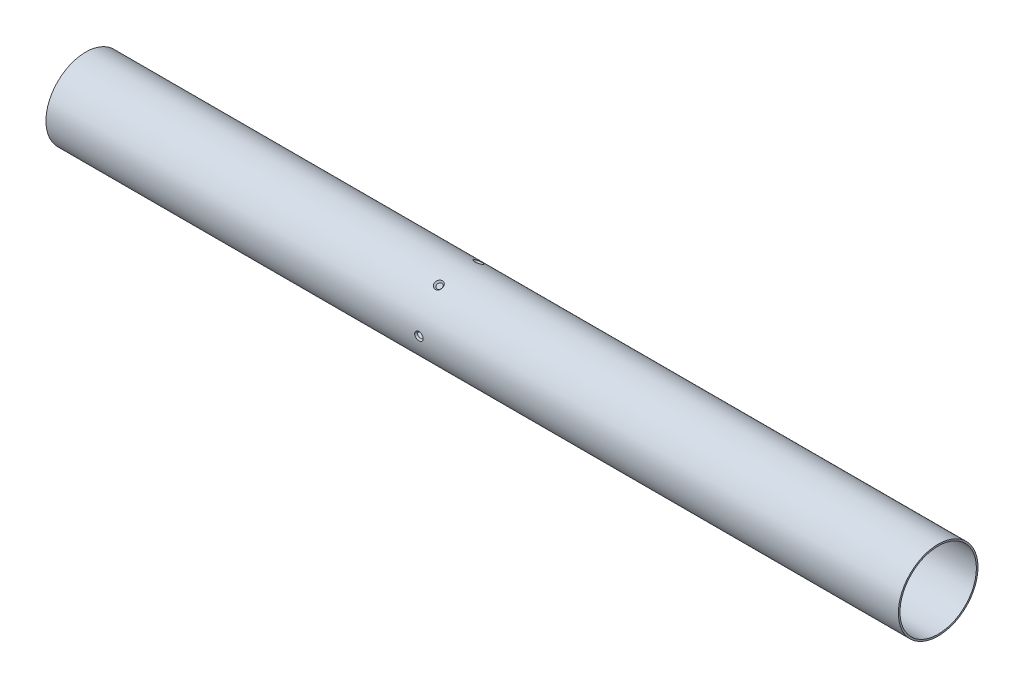
from build123d import *

# Parameters (mm, degrees)
SKETCH1_R           = 28.4734
SKETCH1_R_2         = 27.3304
BOSS_EXTRUDE1_DEPTH = 609.6
CIRPATTERN1_COUNT   = 6


# Read off the part's stored shape, not the designer's step: CSK for #5 Flat Head Machine Screw1
with BuildPart() as part:
    # Sketch1 → Boss-Extrude1 (new body)
    with BuildSketch(Plane(origin=(0, 0, 0), x_dir=(0, 0, -1), z_dir=(1, 0, 0))):
        with Locations(Location((0, 0, 0), (0, 0, 180))):
            Circle(SKETCH1_R)
        with Locations(Location((0, 0, 0), (0, 0, 180))):
            Circle(SKETCH1_R_2, mode=Mode.SUBTRACT)
    extrude(amount=BOSS_EXTRUDE1_DEPTH)

    # CSK for #5 Flat Head Machine Screw1 outl → CSK for #5 Flat Head Machine Screw1 (revolve, cut)
    with BuildSketch(Plane(origin=(266.7, 0, 0), x_dir=(1, 0, 0), z_dir=(0, -1, 0))):
        Polygon((3.001715891, 28.473440077), (0, 28.473440077), (0, 27.260877218), (1.947651078, 27.260877218), align=None)
    csk_for_5_flat_head_machine_screw1 = revolve(axis=Axis((266.7, 0, 0), (0, 0, 1)), mode=Mode.SUBTRACT)

    # CirPattern1: CSK for #5 Flat Head Machine Screw1 ×6 about axis
    cirpattern1_axis = Axis((609.6, 0, 0), (-1, 0, 0))
    for i in range(1, CIRPATTERN1_COUNT):
        add(csk_for_5_flat_head_machine_screw1.rotate(cirpattern1_axis, i * 360 / CIRPATTERN1_COUNT), mode=Mode.SUBTRACT)


solid = part.part
